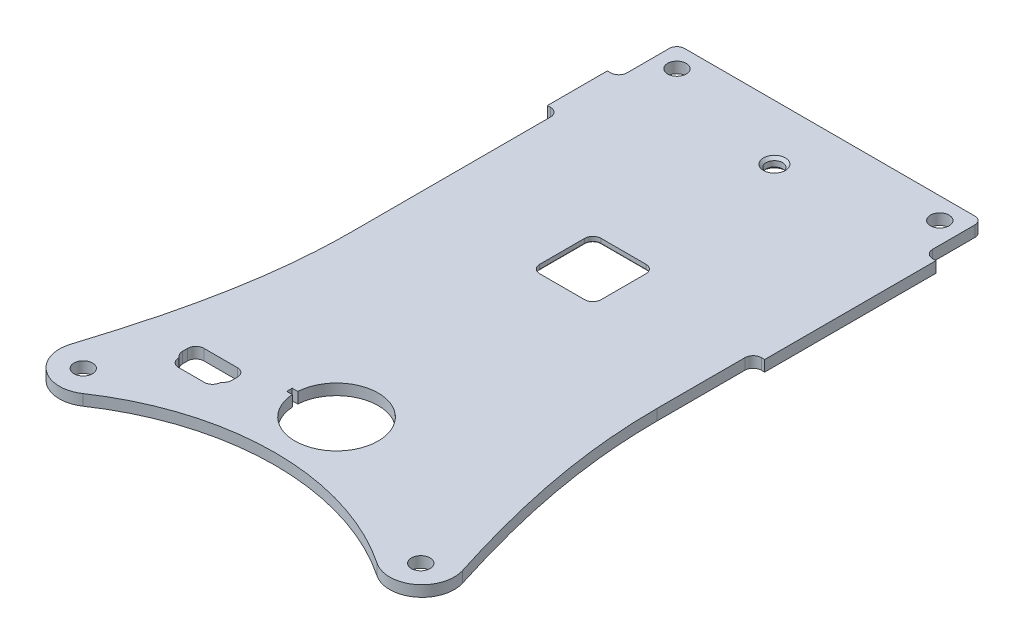
from build123d import *

# Parameters (mm, degrees)
VERT_ROD_W_VTULKA_1_START = 28
VERT_ROD_W_VTULKA_1_DEPTH = 2
CUT_EXTRUDE_1_DEPTH       = 2
HOLE_WIZARD_M32_D         = 3.4
HOLE_WIZARD_M32_DEPTH     = 2
HOLE_WIZARD_M32_TIP       = 1.021463052
HOLE_WIZARD_M33_D         = 3.4
HOLE_WIZARD_M33_DEPTH     = 2
HOLE_WIZARD_M33_TIP       = 1.021463052
HOLE_WIZARD_M34_D         = 3.4
HOLE_WIZARD_M34_DEPTH     = 2
HOLE_WIZARD_M34_TIP       = 1.021463052
HOLE_WIZARD_M35_D         = 3.4
HOLE_WIZARD_M35_DEPTH     = 2
HOLE_WIZARD_M35_TIP       = 1.021463052
HOLE_WIZARD_M36_D         = 3.4
HOLE_WIZARD_M36_DEPTH     = 2
HOLE_WIZARD_M36_TIP       = 1.021463052
HOLE_WIZARD_M37_D         = 3.4
HOLE_WIZARD_M37_DEPTH     = 2
HOLE_WIZARD_M37_TIP       = 1.021463052
HOLE_WIZARD_M38_D         = 3.4
HOLE_WIZARD_M38_DEPTH     = 2
HOLE_WIZARD_M38_TIP       = 1.021463052
HOLE_WIZARD_M39_D         = 3.4
HOLE_WIZARD_M39_DEPTH     = 2
HOLE_WIZARD_M39_TIP       = 1.021463052
HOLE_WIZARD_M310_D        = 3.4
HOLE_WIZARD_M310_DEPTH    = 2
HOLE_WIZARD_M310_TIP      = 1.021463052
HOLE_WIZARD_M311_D        = 3.4
HOLE_WIZARD_M311_DEPTH    = 2
HOLE_WIZARD_M311_TIP      = 1.021463052
SKETCH_25_W               = 2.1
SKETCH_25_H               = 31.28
EXTRUDE_1_DEPTH           = 2
HOLE_WIZARD_M312_D        = 3.4
HOLE_WIZARD_M312_DEPTH    = 2
HOLE_WIZARD_M312_TIP      = 1.021463052
HOLE_WIZARD_M313_D        = 3.4
HOLE_WIZARD_M313_DEPTH    = 2
HOLE_WIZARD_M313_TIP      = 1.021463052
HOLE_WIZARD_M314_D        = 3.4
HOLE_WIZARD_M314_DEPTH    = 2
HOLE_WIZARD_M314_TIP      = 1.021463052
HOLE_WIZARD_M315_D        = 3.4
HOLE_WIZARD_M315_DEPTH    = 2
HOLE_WIZARD_M315_TIP      = 1.021463052
HOLE_WIZARD_M316_D        = 3.4
HOLE_WIZARD_M316_DEPTH    = 2
HOLE_WIZARD_M316_TIP      = 1.021463052
HOLE_WIZARD_M317_D        = 3.4
HOLE_WIZARD_M317_DEPTH    = 2
HOLE_WIZARD_M317_TIP      = 1.021463052
HOLE_WIZARD_M318_D        = 3.4
HOLE_WIZARD_M318_DEPTH    = 2
HOLE_WIZARD_M318_TIP      = 1.021463052
HOLE_WIZARD_M319_D        = 3.4
HOLE_WIZARD_M319_DEPTH    = 2
HOLE_WIZARD_M319_TIP      = 1.021463052
HOLE_WIZARD_M320_D        = 3.4
HOLE_WIZARD_M320_DEPTH    = 2
HOLE_WIZARD_M320_TIP      = 1.021463052
HOLE_WIZARD_M321_D        = 3.4
HOLE_WIZARD_M321_DEPTH    = 2
HOLE_WIZARD_M321_TIP      = 1.021463052
HOLE_WIZARD_M322_D        = 3.4
HOLE_WIZARD_M322_DEPTH    = 2
HOLE_WIZARD_M322_TIP      = 1.021463052
HOLE_WIZARD_M323_D        = 3.4
HOLE_WIZARD_M323_DEPTH    = 2
HOLE_WIZARD_M323_TIP      = 1.021463052
HOLE_WIZARD_M324_D        = 3.4
HOLE_WIZARD_M324_DEPTH    = 2
HOLE_WIZARD_M324_TIP      = 1.021463052
HOLE_WIZARD_M325_D        = 3.4
HOLE_WIZARD_M325_DEPTH    = 2
HOLE_WIZARD_M325_TIP      = 1.021463052
HOLE_WIZARD_M326_D        = 3.4
HOLE_WIZARD_M326_DEPTH    = 2
HOLE_WIZARD_M326_TIP      = 1.021463052
HOLE_WIZARD_M327_D        = 3.4
HOLE_WIZARD_M327_DEPTH    = 2
HOLE_WIZARD_M327_TIP      = 1.021463052
HOLE_WIZARD_M328_D        = 3.4
HOLE_WIZARD_M328_DEPTH    = 2
HOLE_WIZARD_M328_TIP      = 1.021463052
HOLE_WIZARD_M329_D        = 3.4
HOLE_WIZARD_M329_DEPTH    = 2
HOLE_WIZARD_M329_TIP      = 1.021463052
FILLET_1_R                = 1.5
HOLE_WIZARD_M330_D        = 3.4
HOLE_WIZARD_M330_DEPTH    = 2
HOLE_WIZARD_M330_TIP      = 1.021463052
HOLE_WIZARD_M331_D        = 3.4
HOLE_WIZARD_M331_DEPTH    = 2
HOLE_WIZARD_M331_TIP      = 1.021463052
HOLE_WIZARD_M332_D        = 3.4
HOLE_WIZARD_M332_DEPTH    = 2
HOLE_WIZARD_M332_TIP      = 1.021463052
HOLE_WIZARD_M333_D        = 3.4
HOLE_WIZARD_M333_DEPTH    = 2
HOLE_WIZARD_M333_TIP      = 1.021463052
HOLE_WIZARD_M334_D        = 3.4
HOLE_WIZARD_M334_DEPTH    = 2
HOLE_WIZARD_M334_TIP      = 1.021463052
CUT_EXTRUDE_2_DEPTH       = 2
HOLE_WIZARD_M335_D        = 3.4
HOLE_WIZARD_M335_DEPTH    = 2
HOLE_WIZARD_M335_TIP      = 1.021463052
SKETCH_76_W               = 2.1
SKETCH_76_H               = 10.96
EXTRUDE_2_DEPTH           = 2
FILLET_2_R                = 1.5
HOLE_WIZARD_M336_D        = 3.4
HOLE_WIZARD_M336_DEPTH    = 2
HOLE_WIZARD_M336_TIP      = 1.021463052
HOLE_WIZARD_M337_D        = 3.4
HOLE_WIZARD_M337_DEPTH    = 2
HOLE_WIZARD_M337_TIP      = 1.021463052
HOLE_WIZARD_M338_D        = 3.4
HOLE_WIZARD_M338_DEPTH    = 2
HOLE_WIZARD_M338_TIP      = 1.021463052
HOLE_WIZARD_M339_D        = 3.4
HOLE_WIZARD_M339_DEPTH    = 2
HOLE_WIZARD_M339_TIP      = 1.021463052
HOLE_WIZARD_M340_D        = 3.4
HOLE_WIZARD_M340_DEPTH    = 2
HOLE_WIZARD_M340_TIP      = 1.021463052
HOLE_WIZARD_M341_D        = 3.4
HOLE_WIZARD_M341_DEPTH    = 2
HOLE_WIZARD_M341_TIP      = 1.021463052
HOLE_WIZARD_M342_D        = 3.4
HOLE_WIZARD_M342_DEPTH    = 2
HOLE_WIZARD_M342_TIP      = 1.021463052
HOLE_WIZARD_M343_D        = 3.4
HOLE_WIZARD_M343_DEPTH    = 2
HOLE_WIZARD_M343_TIP      = 1.021463052
HOLE_WIZARD_M344_D        = 3.4
HOLE_WIZARD_M344_DEPTH    = 2
HOLE_WIZARD_M344_TIP      = 1.021463052
HOLE_WIZARD_M345_D        = 3.4
HOLE_WIZARD_M345_DEPTH    = 2
HOLE_WIZARD_M345_TIP      = 1.021463052
HOLE_WIZARD_M346_D        = 3.4
HOLE_WIZARD_M346_DEPTH    = 2
HOLE_WIZARD_M346_TIP      = 1.021463052
HOLE_WIZARD_M347_D        = 3.4
HOLE_WIZARD_M347_DEPTH    = 2
HOLE_WIZARD_M347_TIP      = 1.021463052
HOLE_WIZARD_M348_D        = 3.4
HOLE_WIZARD_M348_DEPTH    = 2
HOLE_WIZARD_M348_TIP      = 1.021463052
HOLE_WIZARD_M349_D        = 3.4
HOLE_WIZARD_M349_DEPTH    = 2
HOLE_WIZARD_M349_TIP      = 1.021463052
HOLE_WIZARD_M350_D        = 3.4
HOLE_WIZARD_M350_DEPTH    = 2
HOLE_WIZARD_M350_TIP      = 1.021463052
HOLE_WIZARD_M351_D        = 3.4
HOLE_WIZARD_M351_DEPTH    = 2
HOLE_WIZARD_M351_TIP      = 1.021463052
HOLE_WIZARD_M352_D        = 3.4
HOLE_WIZARD_M352_DEPTH    = 2
HOLE_WIZARD_M352_TIP      = 1.021463052
HOLE_WIZARD_M353_D        = 3.4
HOLE_WIZARD_M353_DEPTH    = 2
HOLE_WIZARD_M353_TIP      = 1.021463052
HOLE_WIZARD_M354_D        = 3.4
HOLE_WIZARD_M354_DEPTH    = 2
HOLE_WIZARD_M354_TIP      = 1.021463052
HOLE_WIZARD_M355_D        = 3.4
HOLE_WIZARD_M355_DEPTH    = 2
HOLE_WIZARD_M355_TIP      = 1.021463052
HOLE_WIZARD_M356_D        = 3.4
HOLE_WIZARD_M356_DEPTH    = 2
HOLE_WIZARD_M356_TIP      = 1.021463052
HOLE_WIZARD_M357_D        = 3.4
HOLE_WIZARD_M357_DEPTH    = 2
HOLE_WIZARD_M357_TIP      = 1.021463052
HOLE_WIZARD_M358_D        = 3.4
HOLE_WIZARD_M358_DEPTH    = 2
HOLE_WIZARD_M358_TIP      = 1.021463052
SKETCH_123_R              = 7.6
CUT_EXTRUDE_3_DEPTH       = 121.787440724
SKETCH_124_W              = 2
SKETCH_124_H              = 1
CUT_EXTRUDE_4_DEPTH       = 121.787440724
CUT_EXTRUDE_5_DEPTH       = 121.787440724
HOLE_WIZARD_M359_D        = 3.4
HOLE_WIZARD_M359_DEPTH    = 2
HOLE_WIZARD_M359_TIP      = 1.021463052
FILLET_3_R                = 1.5
SKETCH_131_W              = 13.5
SKETCH_131_H              = 13.5
CUT_EXTRUDE_6_DEPTH       = 1.2
FILLET_4_R                = 1.5
SKETCH_132_R              = 1.5
CUT_EXTRUDE_7_DEPTH       = 121.787440724
CHAMFER_1_SIZE            = 0.5
HOLE_WIZARD_M360_D        = 3.4
HOLE_WIZARD_M360_DEPTH    = 2
HOLE_WIZARD_M360_TIP      = 1.021463052


# Read off the part's stored shape, not the designer's step: Припуск-Vert_rod_w_vtulka-1
with BuildPart() as part:
    # Припуск-Vert_rod_w_vtulka-1 outline → Припуск-Vert_rod_w_vtulka-1 (new body)
    with BuildSketch(Plane(origin=(0, 0, 0), x_dir=(1, 0, 0), z_dir=(0, 1, 0)).offset(VERT_ROD_W_VTULKA_1_START)):
        with BuildLine():
            Line((57.9, -50), (57.9, 9.4))
            Line((57.9, 9.4), (2.1, 9.4))
            Line((2.1, 9.4), (2.1, -50))
            add(Edge.make_bspline(
                [(2.1, -50), (2.099999708, -53.702093756), (1.892934302, -57.393018514), (1.115992256, -64.755298157), (0.549431015, -68.409554715), (-1.580606832, -79.306490561), (-3.568754299, -86.422318434), (-5.796769802, -93.474666863)],
                knots=[0, 0, 0, 0, 0.25, 0.25, 0.5, 0.5, 1, 1, 1, 1], degree=3))
            ThreePointArc((-5.796769802, -93.474666863), (-3.669922454, -99.944406822), (3.13868063, -100.099128581))
            ThreePointArc((3.13868063, -100.099128581), (30.000000814, -91.89999981), (56.86132072, -100.09912949))
            ThreePointArc((56.86132072, -100.09912949), (63.66953295, -99.944697708), (65.797056658, -93.475598404))
            add(Edge.make_bspline(
                [(65.797056658, -93.475598404), (64.681861992, -89.945689128), (63.625509471, -86.39851392), (61.715383372, -79.244721015), (60.863770171, -75.643731412), (59.444825005, -68.375684643), (58.880489881, -64.726556831), (58.107463811, -57.392195393), (57.9, -53.70670524), (57.9, -50)],
                knots=[0, 0, 0, 0, 0.25, 0.25, 0.5, 0.5, 0.75, 0.75, 1, 1, 1, 1], degree=3))
        make_face()
    extrude(amount=VERT_ROD_W_VTULKA_1_DEPTH)

    # Эскиз1 → Вырез-Вытянуть1 (cut)
    with BuildSketch(Plane(origin=(0, 30, 0), x_dir=(1, 0, 0), z_dir=(0, 1, 0))):
        with BuildLine():
            Line((10.05, -87.25), (10.06, -87.25))
            Line((10.06, -87.25), (12.450000002, -87.25))
            ThreePointArc((12.450000002, -87.25), (13.510660172, -86.810660172), (13.95, -85.750000002))
            Line((13.95, -85.750000002), (13.95, -85.747056275))
            Line((13.95, -85.747056275), (14.210660172, -85.486396103))
            ThreePointArc((14.210660172, -85.486396103), (14.535819299, -84.99976108), (14.65, -84.425735932))
            Line((14.65, -84.425735932), (14.65, -83.399999998))
            ThreePointArc((14.65, -83.399999998), (14.210660172, -82.339339828), (13.150000002, -81.9))
            Line((13.150000002, -81.9), (7.049999998, -81.9))
            ThreePointArc((7.049999998, -81.9), (5.989339828, -82.339339828), (5.550000001, -83.399999998))
            Line((5.550000001, -83.399999998), (5.550000002, -84.334015506))
            ThreePointArc((5.550000002, -84.334015506), (5.664180703, -84.908040653), (5.989339828, -85.394675676))
            Line((5.989339828, -85.394675676), (6.25, -85.655335849))
            Line((6.25, -85.655335849), (6.25, -85.750000002))
            ThreePointArc((6.25, -85.750000002), (6.689339828, -86.810660172), (7.749999998, -87.25))
            Line((7.749999998, -87.25), (10.05, -87.25))
        make_face()
    extrude(amount=-CUT_EXTRUDE_1_DEPTH, mode=Mode.SUBTRACT)

    # Отверстие с зазором M32
    with Locations(Plane(origin=(-23.477702409, 30, -0.712313714), x_dir=(1, 0, 0), z_dir=(0, 1, 0))):
        with Locations((29.477702409, 4.787686286), (77.477702409, 4.787686286), (84.288969806, -96.800804138), (22.666435012, -96.800804138)):
            Hole(HOLE_WIZARD_M32_D / 2, depth=HOLE_WIZARD_M32_DEPTH)
            with Locations((0, 0, -(HOLE_WIZARD_M32_DEPTH + HOLE_WIZARD_M32_TIP / 2))):  # 118° drill point
                Cone(0, HOLE_WIZARD_M32_D / 2, HOLE_WIZARD_M32_TIP, mode=Mode.SUBTRACT)

    # Отверстие с зазором M33
    with Locations(Plane(origin=(-23.477702409, 30, -0.712313714), x_dir=(1, 0, 0), z_dir=(0, 1, 0))):
        with Locations((29.477702409, 4.787686286), (77.477702409, 4.787686286), (84.288969806, -96.800804138), (22.666435012, -96.800804138)):
            Hole(HOLE_WIZARD_M33_D / 2, depth=HOLE_WIZARD_M33_DEPTH)
            with Locations((0, 0, -(HOLE_WIZARD_M33_DEPTH + HOLE_WIZARD_M33_TIP / 2))):  # 118° drill point
                Cone(0, HOLE_WIZARD_M33_D / 2, HOLE_WIZARD_M33_TIP, mode=Mode.SUBTRACT)

    # Отверстие с зазором M34
    with Locations(Plane(origin=(-23.477702409, 30, -0.712313714), x_dir=(1, 0, 0), z_dir=(0, 1, 0))):
        with Locations((29.477702409, 4.787686286), (77.477702409, 4.787686286), (84.288969806, -96.800804138), (22.666435012, -96.800804138)):
            Hole(HOLE_WIZARD_M34_D / 2, depth=HOLE_WIZARD_M34_DEPTH)
            with Locations((0, 0, -(HOLE_WIZARD_M34_DEPTH + HOLE_WIZARD_M34_TIP / 2))):  # 118° drill point
                Cone(0, HOLE_WIZARD_M34_D / 2, HOLE_WIZARD_M34_TIP, mode=Mode.SUBTRACT)

    # Отверстие с зазором M35
    with Locations(Plane(origin=(-23.477702409, 30, -0.712313714), x_dir=(1, 0, 0), z_dir=(0, 1, 0))):
        with Locations((29.477702409, 4.787686286), (77.477702409, 4.787686286), (84.288969806, -96.800804138), (22.666435012, -96.800804138)):
            Hole(HOLE_WIZARD_M35_D / 2, depth=HOLE_WIZARD_M35_DEPTH)
            with Locations((0, 0, -(HOLE_WIZARD_M35_DEPTH + HOLE_WIZARD_M35_TIP / 2))):  # 118° drill point
                Cone(0, HOLE_WIZARD_M35_D / 2, HOLE_WIZARD_M35_TIP, mode=Mode.SUBTRACT)

    # Отверстие с зазором M36
    with Locations(Plane(origin=(-23.477702409, 30, -0.712313714), x_dir=(1, 0, 0), z_dir=(0, 1, 0))):
        with Locations((29.477702409, 4.787686286), (77.477702409, 4.787686286), (84.288969806, -96.800804138), (22.666435012, -96.800804138)):
            Hole(HOLE_WIZARD_M36_D / 2, depth=HOLE_WIZARD_M36_DEPTH)
            with Locations((0, 0, -(HOLE_WIZARD_M36_DEPTH + HOLE_WIZARD_M36_TIP / 2))):  # 118° drill point
                Cone(0, HOLE_WIZARD_M36_D / 2, HOLE_WIZARD_M36_TIP, mode=Mode.SUBTRACT)

    # Отверстие с зазором M37
    with Locations(Plane(origin=(-23.477702409, 30, -0.712313714), x_dir=(1, 0, 0), z_dir=(0, 1, 0))):
        with Locations((29.477702409, 4.787686286), (77.477702409, 4.787686286), (84.288969806, -96.800804138), (22.666435012, -96.800804138)):
            Hole(HOLE_WIZARD_M37_D / 2, depth=HOLE_WIZARD_M37_DEPTH)
            with Locations((0, 0, -(HOLE_WIZARD_M37_DEPTH + HOLE_WIZARD_M37_TIP / 2))):  # 118° drill point
                Cone(0, HOLE_WIZARD_M37_D / 2, HOLE_WIZARD_M37_TIP, mode=Mode.SUBTRACT)

    # Отверстие с зазором M38
    with Locations(Plane(origin=(-23.477702409, 30, -0.712313714), x_dir=(1, 0, 0), z_dir=(0, 1, 0))):
        with Locations((29.477702409, 4.787686286), (77.477702409, 4.787686286), (84.288969806, -96.800804138), (22.666435012, -96.800804138)):
            Hole(HOLE_WIZARD_M38_D / 2, depth=HOLE_WIZARD_M38_DEPTH)
            with Locations((0, 0, -(HOLE_WIZARD_M38_DEPTH + HOLE_WIZARD_M38_TIP / 2))):  # 118° drill point
                Cone(0, HOLE_WIZARD_M38_D / 2, HOLE_WIZARD_M38_TIP, mode=Mode.SUBTRACT)

    # Отверстие с зазором M39
    with Locations(Plane(origin=(-23.477702409, 30, -0.712313714), x_dir=(1, 0, 0), z_dir=(0, 1, 0))):
        with Locations((29.477702409, 4.787686286), (77.477702409, 4.787686286), (84.288969806, -96.800804138), (22.666435012, -96.800804138)):
            Hole(HOLE_WIZARD_M39_D / 2, depth=HOLE_WIZARD_M39_DEPTH)
            with Locations((0, 0, -(HOLE_WIZARD_M39_DEPTH + HOLE_WIZARD_M39_TIP / 2))):  # 118° drill point
                Cone(0, HOLE_WIZARD_M39_D / 2, HOLE_WIZARD_M39_TIP, mode=Mode.SUBTRACT)

    # Отверстие с зазором M310
    with Locations(Plane(origin=(-23.477702409, 30, -0.712313714), x_dir=(1, 0, 0), z_dir=(0, 1, 0))):
        with Locations((29.477702409, 4.787686286), (77.477702409, 4.787686286), (84.288969806, -96.800804138), (22.666435012, -96.800804138)):
            Hole(HOLE_WIZARD_M310_D / 2, depth=HOLE_WIZARD_M310_DEPTH)
            with Locations((0, 0, -(HOLE_WIZARD_M310_DEPTH + HOLE_WIZARD_M310_TIP / 2))):  # 118° drill point
                Cone(0, HOLE_WIZARD_M310_D / 2, HOLE_WIZARD_M310_TIP, mode=Mode.SUBTRACT)

    # Отверстие с зазором M311
    with Locations(Plane(origin=(-23.477702409, 30, -0.712313714), x_dir=(1, 0, 0), z_dir=(0, 1, 0))):
        with Locations((29.477702409, 4.787686286), (77.477702409, 4.787686286), (84.288969806, -96.800804138), (22.666435012, -96.800804138)):
            Hole(HOLE_WIZARD_M311_D / 2, depth=HOLE_WIZARD_M311_DEPTH)
            with Locations((0, 0, -(HOLE_WIZARD_M311_DEPTH + HOLE_WIZARD_M311_TIP / 2))):  # 118° drill point
                Cone(0, HOLE_WIZARD_M311_D / 2, HOLE_WIZARD_M311_TIP, mode=Mode.SUBTRACT)

    # Эскиз25 → Бобышка-Вытянуть1 (add)
    with BuildSketch(Plane(origin=(0, 30, 0), x_dir=(1, 0, 0), z_dir=(0, 1, 0))):
        with Locations((58.95, -16.84)):
            Rectangle(SKETCH_25_W, SKETCH_25_H)
    extrude(amount=-EXTRUDE_1_DEPTH)

    # Отверстие с зазором M312
    with Locations(Plane(origin=(-23.477702409, 30, -0.712313714), x_dir=(1, 0, 0), z_dir=(0, 1, 0))):
        with Locations((29.477702409, 4.787686286), (77.477702409, 4.787686286), (84.288969806, -96.800804138), (22.666435012, -96.800804138)):
            Hole(HOLE_WIZARD_M312_D / 2, depth=HOLE_WIZARD_M312_DEPTH)
            with Locations((0, 0, -(HOLE_WIZARD_M312_DEPTH + HOLE_WIZARD_M312_TIP / 2))):  # 118° drill point
                Cone(0, HOLE_WIZARD_M312_D / 2, HOLE_WIZARD_M312_TIP, mode=Mode.SUBTRACT)

    # Отверстие с зазором M313
    with Locations(Plane(origin=(-23.477702409, 30, -0.712313714), x_dir=(1, 0, 0), z_dir=(0, 1, 0))):
        with Locations((29.477702409, 4.787686286), (77.477702409, 4.787686286), (84.288969806, -96.800804138), (22.666435012, -96.800804138)):
            Hole(HOLE_WIZARD_M313_D / 2, depth=HOLE_WIZARD_M313_DEPTH)
            with Locations((0, 0, -(HOLE_WIZARD_M313_DEPTH + HOLE_WIZARD_M313_TIP / 2))):  # 118° drill point
                Cone(0, HOLE_WIZARD_M313_D / 2, HOLE_WIZARD_M313_TIP, mode=Mode.SUBTRACT)

    # Отверстие с зазором M314
    with Locations(Plane(origin=(-23.477702409, 30, -0.712313714), x_dir=(1, 0, 0), z_dir=(0, 1, 0))):
        with Locations((29.477702409, 4.787686286), (77.477702409, 4.787686286), (84.288969806, -96.800804138), (22.666435012, -96.800804138)):
            Hole(HOLE_WIZARD_M314_D / 2, depth=HOLE_WIZARD_M314_DEPTH)
            with Locations((0, 0, -(HOLE_WIZARD_M314_DEPTH + HOLE_WIZARD_M314_TIP / 2))):  # 118° drill point
                Cone(0, HOLE_WIZARD_M314_D / 2, HOLE_WIZARD_M314_TIP, mode=Mode.SUBTRACT)

    # Отверстие с зазором M315
    with Locations(Plane(origin=(-23.477702409, 30, -0.712313714), x_dir=(1, 0, 0), z_dir=(0, 1, 0))):
        with Locations((29.477702409, 4.787686286), (77.477702409, 4.787686286), (84.288969806, -96.800804138), (22.666435012, -96.800804138)):
            Hole(HOLE_WIZARD_M315_D / 2, depth=HOLE_WIZARD_M315_DEPTH)
            with Locations((0, 0, -(HOLE_WIZARD_M315_DEPTH + HOLE_WIZARD_M315_TIP / 2))):  # 118° drill point
                Cone(0, HOLE_WIZARD_M315_D / 2, HOLE_WIZARD_M315_TIP, mode=Mode.SUBTRACT)

    # Отверстие с зазором M316
    with Locations(Plane(origin=(-23.477702409, 30, -0.712313714), x_dir=(1, 0, 0), z_dir=(0, 1, 0))):
        with Locations((29.477702409, 4.787686286), (77.477702409, 4.787686286), (84.288969806, -96.800804138), (22.666435012, -96.800804138)):
            Hole(HOLE_WIZARD_M316_D / 2, depth=HOLE_WIZARD_M316_DEPTH)
            with Locations((0, 0, -(HOLE_WIZARD_M316_DEPTH + HOLE_WIZARD_M316_TIP / 2))):  # 118° drill point
                Cone(0, HOLE_WIZARD_M316_D / 2, HOLE_WIZARD_M316_TIP, mode=Mode.SUBTRACT)

    # Отверстие с зазором M317
    with Locations(Plane(origin=(-23.477702409, 30, -0.712313714), x_dir=(1, 0, 0), z_dir=(0, 1, 0))):
        with Locations((29.477702409, 4.787686286), (77.477702409, 4.787686286), (84.288969806, -96.800804138), (22.666435012, -96.800804138)):
            Hole(HOLE_WIZARD_M317_D / 2, depth=HOLE_WIZARD_M317_DEPTH)
            with Locations((0, 0, -(HOLE_WIZARD_M317_DEPTH + HOLE_WIZARD_M317_TIP / 2))):  # 118° drill point
                Cone(0, HOLE_WIZARD_M317_D / 2, HOLE_WIZARD_M317_TIP, mode=Mode.SUBTRACT)

    # Отверстие с зазором M318
    with Locations(Plane(origin=(-23.477702409, 30, -0.712313714), x_dir=(1, 0, 0), z_dir=(0, 1, 0))):
        with Locations((29.477702409, 4.787686286), (77.477702409, 4.787686286), (84.288969806, -96.800804138), (22.666435012, -96.800804138)):
            Hole(HOLE_WIZARD_M318_D / 2, depth=HOLE_WIZARD_M318_DEPTH)
            with Locations((0, 0, -(HOLE_WIZARD_M318_DEPTH + HOLE_WIZARD_M318_TIP / 2))):  # 118° drill point
                Cone(0, HOLE_WIZARD_M318_D / 2, HOLE_WIZARD_M318_TIP, mode=Mode.SUBTRACT)

    # Отверстие с зазором M319
    with Locations(Plane(origin=(-23.477702409, 30, -0.712313714), x_dir=(1, 0, 0), z_dir=(0, 1, 0))):
        with Locations((29.477702409, 4.787686286), (77.477702409, 4.787686286), (84.288969806, -96.800804138), (22.666435012, -96.800804138)):
            Hole(HOLE_WIZARD_M319_D / 2, depth=HOLE_WIZARD_M319_DEPTH)
            with Locations((0, 0, -(HOLE_WIZARD_M319_DEPTH + HOLE_WIZARD_M319_TIP / 2))):  # 118° drill point
                Cone(0, HOLE_WIZARD_M319_D / 2, HOLE_WIZARD_M319_TIP, mode=Mode.SUBTRACT)

    # Отверстие с зазором M320
    with Locations(Plane(origin=(-23.477702409, 30, -0.712313714), x_dir=(1, 0, 0), z_dir=(0, 1, 0))):
        with Locations((29.477702409, 4.787686286), (77.477702409, 4.787686286), (84.288969806, -96.800804138), (22.666435012, -96.800804138)):
            Hole(HOLE_WIZARD_M320_D / 2, depth=HOLE_WIZARD_M320_DEPTH)
            with Locations((0, 0, -(HOLE_WIZARD_M320_DEPTH + HOLE_WIZARD_M320_TIP / 2))):  # 118° drill point
                Cone(0, HOLE_WIZARD_M320_D / 2, HOLE_WIZARD_M320_TIP, mode=Mode.SUBTRACT)

    # Отверстие с зазором M321
    with Locations(Plane(origin=(-23.477702409, 30, -0.712313714), x_dir=(1, 0, 0), z_dir=(0, 1, 0))):
        with Locations((29.477702409, 4.787686286), (77.477702409, 4.787686286), (84.288969806, -96.800804138), (22.666435012, -96.800804138)):
            Hole(HOLE_WIZARD_M321_D / 2, depth=HOLE_WIZARD_M321_DEPTH)
            with Locations((0, 0, -(HOLE_WIZARD_M321_DEPTH + HOLE_WIZARD_M321_TIP / 2))):  # 118° drill point
                Cone(0, HOLE_WIZARD_M321_D / 2, HOLE_WIZARD_M321_TIP, mode=Mode.SUBTRACT)

    # Отверстие с зазором M322
    with Locations(Plane(origin=(-23.477702409, 30, -0.712313714), x_dir=(1, 0, 0), z_dir=(0, 1, 0))):
        with Locations((29.477702409, 4.787686286), (77.477702409, 4.787686286), (84.288969806, -96.800804138), (22.666435012, -96.800804138)):
            Hole(HOLE_WIZARD_M322_D / 2, depth=HOLE_WIZARD_M322_DEPTH)
            with Locations((0, 0, -(HOLE_WIZARD_M322_DEPTH + HOLE_WIZARD_M322_TIP / 2))):  # 118° drill point
                Cone(0, HOLE_WIZARD_M322_D / 2, HOLE_WIZARD_M322_TIP, mode=Mode.SUBTRACT)

    # Отверстие с зазором M323
    with Locations(Plane(origin=(-23.477702409, 30, -0.712313714), x_dir=(1, 0, 0), z_dir=(0, 1, 0))):
        with Locations((29.477702409, 4.787686286), (77.477702409, 4.787686286), (84.288969806, -96.800804138), (22.666435012, -96.800804138)):
            Hole(HOLE_WIZARD_M323_D / 2, depth=HOLE_WIZARD_M323_DEPTH)
            with Locations((0, 0, -(HOLE_WIZARD_M323_DEPTH + HOLE_WIZARD_M323_TIP / 2))):  # 118° drill point
                Cone(0, HOLE_WIZARD_M323_D / 2, HOLE_WIZARD_M323_TIP, mode=Mode.SUBTRACT)

    # Отверстие с зазором M324
    with Locations(Plane(origin=(-23.477702409, 30, -0.712313714), x_dir=(1, 0, 0), z_dir=(0, 1, 0))):
        with Locations((29.477702409, 4.787686286), (77.477702409, 4.787686286), (84.288969806, -96.800804138), (22.666435012, -96.800804138)):
            Hole(HOLE_WIZARD_M324_D / 2, depth=HOLE_WIZARD_M324_DEPTH)
            with Locations((0, 0, -(HOLE_WIZARD_M324_DEPTH + HOLE_WIZARD_M324_TIP / 2))):  # 118° drill point
                Cone(0, HOLE_WIZARD_M324_D / 2, HOLE_WIZARD_M324_TIP, mode=Mode.SUBTRACT)

    # Отверстие с зазором M325
    with Locations(Plane(origin=(-23.477702409, 30, -0.712313714), x_dir=(1, 0, 0), z_dir=(0, 1, 0))):
        with Locations((29.477702409, 4.787686286), (77.477702409, 4.787686286), (84.288969806, -96.800804138), (22.666435012, -96.800804138)):
            Hole(HOLE_WIZARD_M325_D / 2, depth=HOLE_WIZARD_M325_DEPTH)
            with Locations((0, 0, -(HOLE_WIZARD_M325_DEPTH + HOLE_WIZARD_M325_TIP / 2))):  # 118° drill point
                Cone(0, HOLE_WIZARD_M325_D / 2, HOLE_WIZARD_M325_TIP, mode=Mode.SUBTRACT)

    # Отверстие с зазором M326
    with Locations(Plane(origin=(-23.477702409, 30, -0.712313714), x_dir=(1, 0, 0), z_dir=(0, 1, 0))):
        with Locations((29.477702409, 4.787686286), (77.477702409, 4.787686286), (84.288969806, -96.800804138), (22.666435012, -96.800804138)):
            Hole(HOLE_WIZARD_M326_D / 2, depth=HOLE_WIZARD_M326_DEPTH)
            with Locations((0, 0, -(HOLE_WIZARD_M326_DEPTH + HOLE_WIZARD_M326_TIP / 2))):  # 118° drill point
                Cone(0, HOLE_WIZARD_M326_D / 2, HOLE_WIZARD_M326_TIP, mode=Mode.SUBTRACT)

    # Отверстие с зазором M327
    with Locations(Plane(origin=(-23.477702409, 30, -0.712313714), x_dir=(1, 0, 0), z_dir=(0, 1, 0))):
        with Locations((29.477702409, 4.787686286), (77.477702409, 4.787686286), (84.288969806, -96.800804138), (22.666435012, -96.800804138)):
            Hole(HOLE_WIZARD_M327_D / 2, depth=HOLE_WIZARD_M327_DEPTH)
            with Locations((0, 0, -(HOLE_WIZARD_M327_DEPTH + HOLE_WIZARD_M327_TIP / 2))):  # 118° drill point
                Cone(0, HOLE_WIZARD_M327_D / 2, HOLE_WIZARD_M327_TIP, mode=Mode.SUBTRACT)

    # Отверстие с зазором M328
    with Locations(Plane(origin=(-23.477702409, 30, -0.712313714), x_dir=(1, 0, 0), z_dir=(0, 1, 0))):
        with Locations((29.477702409, 4.787686286), (77.477702409, 4.787686286), (84.288969806, -96.800804138), (22.666435012, -96.800804138)):
            Hole(HOLE_WIZARD_M328_D / 2, depth=HOLE_WIZARD_M328_DEPTH)
            with Locations((0, 0, -(HOLE_WIZARD_M328_DEPTH + HOLE_WIZARD_M328_TIP / 2))):  # 118° drill point
                Cone(0, HOLE_WIZARD_M328_D / 2, HOLE_WIZARD_M328_TIP, mode=Mode.SUBTRACT)

    # Отверстие с зазором M329
    with Locations(Plane(origin=(-23.477702409, 30, -0.712313714), x_dir=(1, 0, 0), z_dir=(0, 1, 0))):
        with Locations((29.477702409, 4.787686286), (77.477702409, 4.787686286), (84.288969806, -96.800804138), (22.666435012, -96.800804138)):
            Hole(HOLE_WIZARD_M329_D / 2, depth=HOLE_WIZARD_M329_DEPTH)
            with Locations((0, 0, -(HOLE_WIZARD_M329_DEPTH + HOLE_WIZARD_M329_TIP / 2))):  # 118° drill point
                Cone(0, HOLE_WIZARD_M329_D / 2, HOLE_WIZARD_M329_TIP, mode=Mode.SUBTRACT)

    # Скругление1
    fillet_1_edges = [part.edges().sort_by_distance(p)[0] for p in [
        (57.9, 29, 32.48),
        (57.9, 29, 1.2),
    ]]
    fillet(fillet_1_edges, radius=FILLET_1_R)

    # Отверстие с зазором M330
    with Locations(Plane(origin=(-23.477702409, 30, -0.712313714), x_dir=(1, 0, 0), z_dir=(0, 1, 0))):
        with Locations((29.477702409, 4.787686286), (77.477702409, 4.787686286), (84.288969806, -96.800804138), (22.666435012, -96.800804138)):
            Hole(HOLE_WIZARD_M330_D / 2, depth=HOLE_WIZARD_M330_DEPTH)
            with Locations((0, 0, -(HOLE_WIZARD_M330_DEPTH + HOLE_WIZARD_M330_TIP / 2))):  # 118° drill point
                Cone(0, HOLE_WIZARD_M330_D / 2, HOLE_WIZARD_M330_TIP, mode=Mode.SUBTRACT)

    # Отверстие с зазором M331
    with Locations(Plane(origin=(-23.477702409, 30, -0.712313714), x_dir=(1, 0, 0), z_dir=(0, 1, 0))):
        with Locations((29.477702409, 4.787686286), (77.477702409, 4.787686286), (84.288969806, -96.800804138), (22.666435012, -96.800804138)):
            Hole(HOLE_WIZARD_M331_D / 2, depth=HOLE_WIZARD_M331_DEPTH)
            with Locations((0, 0, -(HOLE_WIZARD_M331_DEPTH + HOLE_WIZARD_M331_TIP / 2))):  # 118° drill point
                Cone(0, HOLE_WIZARD_M331_D / 2, HOLE_WIZARD_M331_TIP, mode=Mode.SUBTRACT)

    # Отверстие с зазором M332
    with Locations(Plane(origin=(-23.477702409, 30, -0.712313714), x_dir=(1, 0, 0), z_dir=(0, 1, 0))):
        with Locations((29.477702409, 4.787686286), (77.477702409, 4.787686286), (84.288969806, -96.800804138), (22.666435012, -96.800804138)):
            Hole(HOLE_WIZARD_M332_D / 2, depth=HOLE_WIZARD_M332_DEPTH)
            with Locations((0, 0, -(HOLE_WIZARD_M332_DEPTH + HOLE_WIZARD_M332_TIP / 2))):  # 118° drill point
                Cone(0, HOLE_WIZARD_M332_D / 2, HOLE_WIZARD_M332_TIP, mode=Mode.SUBTRACT)

    # Отверстие с зазором M333
    with Locations(Plane(origin=(-23.477702409, 30, -0.712313714), x_dir=(1, 0, 0), z_dir=(0, 1, 0))):
        with Locations((29.477702409, 4.787686286), (77.477702409, 4.787686286), (84.288969806, -96.800804138), (22.666435012, -96.800804138)):
            Hole(HOLE_WIZARD_M333_D / 2, depth=HOLE_WIZARD_M333_DEPTH)
            with Locations((0, 0, -(HOLE_WIZARD_M333_DEPTH + HOLE_WIZARD_M333_TIP / 2))):  # 118° drill point
                Cone(0, HOLE_WIZARD_M333_D / 2, HOLE_WIZARD_M333_TIP, mode=Mode.SUBTRACT)

    # Отверстие с зазором M334
    with Locations(Plane(origin=(-23.477702409, 30, -0.712313714), x_dir=(1, 0, 0), z_dir=(0, 1, 0))):
        with Locations((29.477702409, 4.787686286), (77.477702409, 4.787686286), (84.288969806, -96.800804138), (22.666435012, -96.800804138)):
            Hole(HOLE_WIZARD_M334_D / 2, depth=HOLE_WIZARD_M334_DEPTH)
            with Locations((0, 0, -(HOLE_WIZARD_M334_DEPTH + HOLE_WIZARD_M334_TIP / 2))):  # 118° drill point
                Cone(0, HOLE_WIZARD_M334_D / 2, HOLE_WIZARD_M334_TIP, mode=Mode.SUBTRACT)

    # Эскиз73 → Вырез-Вытянуть2 (cut)
    with BuildSketch(Plane(origin=(0, 30, 0), x_dir=(1, 0, 0), z_dir=(0, 1, 0))):
        with BuildLine():
            Line((57.9, 9.4), (56.5, 9.4))
            ThreePointArc((56.5, 9.4), (57.489949494, 8.989949494), (57.9, 8))
            Line((57.9, 8), (57.9, 9.4))
        make_face()
        with BuildLine():
            Line((2.1, 9.4), (2.1, 8))
            ThreePointArc((2.1, 8), (2.510050506, 8.989949494), (3.5, 9.4))
            Line((3.5, 9.4), (2.1, 9.4))
        make_face()
    extrude(amount=-CUT_EXTRUDE_2_DEPTH, mode=Mode.SUBTRACT)

    # Отверстие с зазором M335
    with Locations(Plane(origin=(-23.477702409, 30, -0.712313714), x_dir=(1, 0, 0), z_dir=(0, 1, 0))):
        with Locations((29.477702409, 4.787686286), (77.477702409, 4.787686286), (84.288969806, -96.800804138), (22.666435012, -96.800804138)):
            Hole(HOLE_WIZARD_M335_D / 2, depth=HOLE_WIZARD_M335_DEPTH)
            with Locations((0, 0, -(HOLE_WIZARD_M335_DEPTH + HOLE_WIZARD_M335_TIP / 2))):  # 118° drill point
                Cone(0, HOLE_WIZARD_M335_D / 2, HOLE_WIZARD_M335_TIP, mode=Mode.SUBTRACT)

    # Эскиз76 → Бобышка-Вытянуть2 (add)
    with BuildSketch(Plane(origin=(0, 30, 0), x_dir=(1, 0, 0), z_dir=(0, 1, 0))):
        with Locations((1.05, -6.68)):
            Rectangle(SKETCH_76_W, SKETCH_76_H)
    extrude(amount=-EXTRUDE_2_DEPTH)

    # Скругление2
    fillet_2_edges = [part.edges().sort_by_distance(p)[0] for p in [
        (2.1, 29, 12.16),
        (2.1, 29, 1.2),
    ]]
    fillet(fillet_2_edges, radius=FILLET_2_R)

    # Отверстие с зазором M336
    with Locations(Plane(origin=(-23.477702409, 30, -0.712313714), x_dir=(1, 0, 0), z_dir=(0, 1, 0))):
        with Locations((29.477702409, 4.787686286), (77.477702409, 4.787686286), (84.288969806, -96.800804138), (22.666435012, -96.800804138)):
            Hole(HOLE_WIZARD_M336_D / 2, depth=HOLE_WIZARD_M336_DEPTH)
            with Locations((0, 0, -(HOLE_WIZARD_M336_DEPTH + HOLE_WIZARD_M336_TIP / 2))):  # 118° drill point
                Cone(0, HOLE_WIZARD_M336_D / 2, HOLE_WIZARD_M336_TIP, mode=Mode.SUBTRACT)

    # Отверстие с зазором M337
    with Locations(Plane(origin=(-23.477702409, 30, -0.712313714), x_dir=(1, 0, 0), z_dir=(0, 1, 0))):
        with Locations((29.477702409, 4.787686286), (77.477702409, 4.787686286), (84.288969806, -96.800804138), (22.666435012, -96.800804138)):
            Hole(HOLE_WIZARD_M337_D / 2, depth=HOLE_WIZARD_M337_DEPTH)
            with Locations((0, 0, -(HOLE_WIZARD_M337_DEPTH + HOLE_WIZARD_M337_TIP / 2))):  # 118° drill point
                Cone(0, HOLE_WIZARD_M337_D / 2, HOLE_WIZARD_M337_TIP, mode=Mode.SUBTRACT)

    # Отверстие с зазором M338
    with Locations(Plane(origin=(-23.477702409, 30, -0.712313714), x_dir=(1, 0, 0), z_dir=(0, 1, 0))):
        with Locations((29.477702409, 4.787686286), (77.477702409, 4.787686286), (84.288969806, -96.800804138), (22.666435012, -96.800804138)):
            Hole(HOLE_WIZARD_M338_D / 2, depth=HOLE_WIZARD_M338_DEPTH)
            with Locations((0, 0, -(HOLE_WIZARD_M338_DEPTH + HOLE_WIZARD_M338_TIP / 2))):  # 118° drill point
                Cone(0, HOLE_WIZARD_M338_D / 2, HOLE_WIZARD_M338_TIP, mode=Mode.SUBTRACT)

    # Отверстие с зазором M339
    with Locations(Plane(origin=(-23.477702409, 30, -0.712313714), x_dir=(1, 0, 0), z_dir=(0, 1, 0))):
        with Locations((29.477702409, 4.787686286), (77.477702409, 4.787686286), (84.288969806, -96.800804138), (22.666435012, -96.800804138)):
            Hole(HOLE_WIZARD_M339_D / 2, depth=HOLE_WIZARD_M339_DEPTH)
            with Locations((0, 0, -(HOLE_WIZARD_M339_DEPTH + HOLE_WIZARD_M339_TIP / 2))):  # 118° drill point
                Cone(0, HOLE_WIZARD_M339_D / 2, HOLE_WIZARD_M339_TIP, mode=Mode.SUBTRACT)

    # Отверстие с зазором M340
    with Locations(Plane(origin=(-23.477702409, 30, -0.712313714), x_dir=(1, 0, 0), z_dir=(0, 1, 0))):
        with Locations((29.477702409, 4.787686286), (77.477702409, 4.787686286), (84.288969806, -96.800804138), (22.666435012, -96.800804138)):
            Hole(HOLE_WIZARD_M340_D / 2, depth=HOLE_WIZARD_M340_DEPTH)
            with Locations((0, 0, -(HOLE_WIZARD_M340_DEPTH + HOLE_WIZARD_M340_TIP / 2))):  # 118° drill point
                Cone(0, HOLE_WIZARD_M340_D / 2, HOLE_WIZARD_M340_TIP, mode=Mode.SUBTRACT)

    # Отверстие с зазором M341
    with Locations(Plane(origin=(-23.477702409, 30, -0.712313714), x_dir=(1, 0, 0), z_dir=(0, 1, 0))):
        with Locations((29.477702409, 4.787686286), (77.477702409, 4.787686286), (84.288969806, -96.800804138), (22.666435012, -96.800804138)):
            Hole(HOLE_WIZARD_M341_D / 2, depth=HOLE_WIZARD_M341_DEPTH)
            with Locations((0, 0, -(HOLE_WIZARD_M341_DEPTH + HOLE_WIZARD_M341_TIP / 2))):  # 118° drill point
                Cone(0, HOLE_WIZARD_M341_D / 2, HOLE_WIZARD_M341_TIP, mode=Mode.SUBTRACT)

    # Отверстие с зазором M342
    with Locations(Plane(origin=(-23.477702409, 30, -0.712313714), x_dir=(1, 0, 0), z_dir=(0, 1, 0))):
        with Locations((29.477702409, 4.787686286), (77.477702409, 4.787686286), (84.288969806, -96.800804138), (22.666435012, -96.800804138)):
            Hole(HOLE_WIZARD_M342_D / 2, depth=HOLE_WIZARD_M342_DEPTH)
            with Locations((0, 0, -(HOLE_WIZARD_M342_DEPTH + HOLE_WIZARD_M342_TIP / 2))):  # 118° drill point
                Cone(0, HOLE_WIZARD_M342_D / 2, HOLE_WIZARD_M342_TIP, mode=Mode.SUBTRACT)

    # Отверстие с зазором M343
    with Locations(Plane(origin=(-23.477702409, 30, -0.712313714), x_dir=(1, 0, 0), z_dir=(0, 1, 0))):
        with Locations((29.477702409, 4.787686286), (77.477702409, 4.787686286), (84.288969806, -96.800804138), (22.666435012, -96.800804138)):
            Hole(HOLE_WIZARD_M343_D / 2, depth=HOLE_WIZARD_M343_DEPTH)
            with Locations((0, 0, -(HOLE_WIZARD_M343_DEPTH + HOLE_WIZARD_M343_TIP / 2))):  # 118° drill point
                Cone(0, HOLE_WIZARD_M343_D / 2, HOLE_WIZARD_M343_TIP, mode=Mode.SUBTRACT)

    # Отверстие с зазором M344
    with Locations(Plane(origin=(-23.477702409, 30, -0.712313714), x_dir=(1, 0, 0), z_dir=(0, 1, 0))):
        with Locations((29.477702409, 4.787686286), (77.477702409, 4.787686286), (84.288969806, -96.800804138), (22.666435012, -96.800804138)):
            Hole(HOLE_WIZARD_M344_D / 2, depth=HOLE_WIZARD_M344_DEPTH)
            with Locations((0, 0, -(HOLE_WIZARD_M344_DEPTH + HOLE_WIZARD_M344_TIP / 2))):  # 118° drill point
                Cone(0, HOLE_WIZARD_M344_D / 2, HOLE_WIZARD_M344_TIP, mode=Mode.SUBTRACT)

    # Отверстие с зазором M345
    with Locations(Plane(origin=(-23.477702409, 30, -0.712313714), x_dir=(1, 0, 0), z_dir=(0, 1, 0))):
        with Locations((29.477702409, 4.787686286), (77.477702409, 4.787686286), (84.288969806, -96.800804138), (22.666435012, -96.800804138)):
            Hole(HOLE_WIZARD_M345_D / 2, depth=HOLE_WIZARD_M345_DEPTH)
            with Locations((0, 0, -(HOLE_WIZARD_M345_DEPTH + HOLE_WIZARD_M345_TIP / 2))):  # 118° drill point
                Cone(0, HOLE_WIZARD_M345_D / 2, HOLE_WIZARD_M345_TIP, mode=Mode.SUBTRACT)

    # Отверстие с зазором M346
    with Locations(Plane(origin=(-23.477702409, 30, -0.712313714), x_dir=(1, 0, 0), z_dir=(0, 1, 0))):
        with Locations((29.477702409, 4.787686286), (77.477702409, 4.787686286), (84.288969806, -96.800804138), (22.666435012, -96.800804138)):
            Hole(HOLE_WIZARD_M346_D / 2, depth=HOLE_WIZARD_M346_DEPTH)
            with Locations((0, 0, -(HOLE_WIZARD_M346_DEPTH + HOLE_WIZARD_M346_TIP / 2))):  # 118° drill point
                Cone(0, HOLE_WIZARD_M346_D / 2, HOLE_WIZARD_M346_TIP, mode=Mode.SUBTRACT)

    # Отверстие с зазором M347
    with Locations(Plane(origin=(-23.477702409, 30, -0.712313714), x_dir=(1, 0, 0), z_dir=(0, 1, 0))):
        with Locations((29.477702409, 4.787686286), (77.477702409, 4.787686286), (84.288969806, -96.800804138), (22.666435012, -96.800804138)):
            Hole(HOLE_WIZARD_M347_D / 2, depth=HOLE_WIZARD_M347_DEPTH)
            with Locations((0, 0, -(HOLE_WIZARD_M347_DEPTH + HOLE_WIZARD_M347_TIP / 2))):  # 118° drill point
                Cone(0, HOLE_WIZARD_M347_D / 2, HOLE_WIZARD_M347_TIP, mode=Mode.SUBTRACT)

    # Отверстие с зазором M348
    with Locations(Plane(origin=(-23.477702409, 30, -0.712313714), x_dir=(1, 0, 0), z_dir=(0, 1, 0))):
        with Locations((29.477702409, 4.787686286), (77.477702409, 4.787686286), (84.288969806, -96.800804138), (22.666435012, -96.800804138)):
            Hole(HOLE_WIZARD_M348_D / 2, depth=HOLE_WIZARD_M348_DEPTH)
            with Locations((0, 0, -(HOLE_WIZARD_M348_DEPTH + HOLE_WIZARD_M348_TIP / 2))):  # 118° drill point
                Cone(0, HOLE_WIZARD_M348_D / 2, HOLE_WIZARD_M348_TIP, mode=Mode.SUBTRACT)

    # Отверстие с зазором M349
    with Locations(Plane(origin=(-23.477702409, 30, -0.712313714), x_dir=(1, 0, 0), z_dir=(0, 1, 0))):
        with Locations((29.477702409, 4.787686286), (77.477702409, 4.787686286), (84.288969806, -96.800804138), (22.666435012, -96.800804138)):
            Hole(HOLE_WIZARD_M349_D / 2, depth=HOLE_WIZARD_M349_DEPTH)
            with Locations((0, 0, -(HOLE_WIZARD_M349_DEPTH + HOLE_WIZARD_M349_TIP / 2))):  # 118° drill point
                Cone(0, HOLE_WIZARD_M349_D / 2, HOLE_WIZARD_M349_TIP, mode=Mode.SUBTRACT)

    # Отверстие с зазором M350
    with Locations(Plane(origin=(-23.477702409, 30, -0.712313714), x_dir=(1, 0, 0), z_dir=(0, 1, 0))):
        with Locations((29.477702409, 4.787686286), (77.477702409, 4.787686286), (84.288969806, -96.800804138), (22.666435012, -96.800804138)):
            Hole(HOLE_WIZARD_M350_D / 2, depth=HOLE_WIZARD_M350_DEPTH)
            with Locations((0, 0, -(HOLE_WIZARD_M350_DEPTH + HOLE_WIZARD_M350_TIP / 2))):  # 118° drill point
                Cone(0, HOLE_WIZARD_M350_D / 2, HOLE_WIZARD_M350_TIP, mode=Mode.SUBTRACT)

    # Отверстие с зазором M351
    with Locations(Plane(origin=(-23.477702409, 30, -0.712313714), x_dir=(1, 0, 0), z_dir=(0, 1, 0))):
        with Locations((29.477702409, 4.787686286), (77.477702409, 4.787686286), (84.288969806, -96.800804138), (22.666435012, -96.800804138)):
            Hole(HOLE_WIZARD_M351_D / 2, depth=HOLE_WIZARD_M351_DEPTH)
            with Locations((0, 0, -(HOLE_WIZARD_M351_DEPTH + HOLE_WIZARD_M351_TIP / 2))):  # 118° drill point
                Cone(0, HOLE_WIZARD_M351_D / 2, HOLE_WIZARD_M351_TIP, mode=Mode.SUBTRACT)

    # Отверстие с зазором M352
    with Locations(Plane(origin=(-23.477702409, 30, -0.712313714), x_dir=(1, 0, 0), z_dir=(0, 1, 0))):
        with Locations((29.477702409, 4.787686286), (77.477702409, 4.787686286), (84.288969806, -96.800804138), (22.666435012, -96.800804138)):
            Hole(HOLE_WIZARD_M352_D / 2, depth=HOLE_WIZARD_M352_DEPTH)
            with Locations((0, 0, -(HOLE_WIZARD_M352_DEPTH + HOLE_WIZARD_M352_TIP / 2))):  # 118° drill point
                Cone(0, HOLE_WIZARD_M352_D / 2, HOLE_WIZARD_M352_TIP, mode=Mode.SUBTRACT)

    # Отверстие с зазором M353
    with Locations(Plane(origin=(-23.477702409, 30, -0.712313714), x_dir=(1, 0, 0), z_dir=(0, 1, 0))):
        with Locations((29.477702409, 4.787686286), (77.477702409, 4.787686286), (84.288969806, -96.800804138), (22.666435012, -96.800804138)):
            Hole(HOLE_WIZARD_M353_D / 2, depth=HOLE_WIZARD_M353_DEPTH)
            with Locations((0, 0, -(HOLE_WIZARD_M353_DEPTH + HOLE_WIZARD_M353_TIP / 2))):  # 118° drill point
                Cone(0, HOLE_WIZARD_M353_D / 2, HOLE_WIZARD_M353_TIP, mode=Mode.SUBTRACT)

    # Отверстие с зазором M354
    with Locations(Plane(origin=(-23.477702409, 30, -0.712313714), x_dir=(1, 0, 0), z_dir=(0, 1, 0))):
        with Locations((29.477702409, 4.787686286), (77.477702409, 4.787686286), (84.288969806, -96.800804138), (22.666435012, -96.800804138)):
            Hole(HOLE_WIZARD_M354_D / 2, depth=HOLE_WIZARD_M354_DEPTH)
            with Locations((0, 0, -(HOLE_WIZARD_M354_DEPTH + HOLE_WIZARD_M354_TIP / 2))):  # 118° drill point
                Cone(0, HOLE_WIZARD_M354_D / 2, HOLE_WIZARD_M354_TIP, mode=Mode.SUBTRACT)

    # Отверстие с зазором M355
    with Locations(Plane(origin=(-23.477702409, 30, -0.712313714), x_dir=(1, 0, 0), z_dir=(0, 1, 0))):
        with Locations((29.477702409, 4.787686286), (77.477702409, 4.787686286), (84.288969806, -96.800804138), (22.666435012, -96.800804138)):
            Hole(HOLE_WIZARD_M355_D / 2, depth=HOLE_WIZARD_M355_DEPTH)
            with Locations((0, 0, -(HOLE_WIZARD_M355_DEPTH + HOLE_WIZARD_M355_TIP / 2))):  # 118° drill point
                Cone(0, HOLE_WIZARD_M355_D / 2, HOLE_WIZARD_M355_TIP, mode=Mode.SUBTRACT)

    # Отверстие с зазором M356
    with Locations(Plane(origin=(-23.477702409, 30, -0.712313714), x_dir=(1, 0, 0), z_dir=(0, 1, 0))):
        with Locations((29.477702409, 4.787686286), (77.477702409, 4.787686286), (84.288969806, -96.800804138), (22.666435012, -96.800804138)):
            Hole(HOLE_WIZARD_M356_D / 2, depth=HOLE_WIZARD_M356_DEPTH)
            with Locations((0, 0, -(HOLE_WIZARD_M356_DEPTH + HOLE_WIZARD_M356_TIP / 2))):  # 118° drill point
                Cone(0, HOLE_WIZARD_M356_D / 2, HOLE_WIZARD_M356_TIP, mode=Mode.SUBTRACT)

    # Отверстие с зазором M357
    with Locations(Plane(origin=(-23.477702409, 30, -0.712313714), x_dir=(1, 0, 0), z_dir=(0, 1, 0))):
        with Locations((29.477702409, 4.787686286), (77.477702409, 4.787686286), (84.288969806, -96.800804138), (22.666435012, -96.800804138)):
            Hole(HOLE_WIZARD_M357_D / 2, depth=HOLE_WIZARD_M357_DEPTH)
            with Locations((0, 0, -(HOLE_WIZARD_M357_DEPTH + HOLE_WIZARD_M357_TIP / 2))):  # 118° drill point
                Cone(0, HOLE_WIZARD_M357_D / 2, HOLE_WIZARD_M357_TIP, mode=Mode.SUBTRACT)

    # Отверстие с зазором M358
    with Locations(Plane(origin=(-23.477702409, 30, -0.712313714), x_dir=(1, 0, 0), z_dir=(0, 1, 0))):
        with Locations((29.477702409, 4.787686286), (77.477702409, 4.787686286), (84.288969806, -96.800804138), (22.666435012, -96.800804138)):
            Hole(HOLE_WIZARD_M358_D / 2, depth=HOLE_WIZARD_M358_DEPTH)
            with Locations((0, 0, -(HOLE_WIZARD_M358_DEPTH + HOLE_WIZARD_M358_TIP / 2))):  # 118° drill point
                Cone(0, HOLE_WIZARD_M358_D / 2, HOLE_WIZARD_M358_TIP, mode=Mode.SUBTRACT)

    # Эскиз123 → Вырез-Вытянуть3 (cut, through all)
    with BuildSketch(Plane(origin=(0, 30, 0), x_dir=(1, 0, 0), z_dir=(0, 1, 0))):
        with Locations(Location((30, -80.64999981, 0), (0, 0, 180))):
            Circle(SKETCH_123_R)
    extrude(amount=-CUT_EXTRUDE_3_DEPTH, mode=Mode.SUBTRACT)

    # Эскиз124 → Вырез-Вытянуть4 (cut, through all)
    with BuildSketch(Plane(origin=(0, 30, 0), x_dir=(1, 0, 0), z_dir=(0, 1, 0))):
        with Locations((22.4, -80.64999981)):
            Rectangle(SKETCH_124_W, SKETCH_124_H)
    extrude(amount=-CUT_EXTRUDE_4_DEPTH, mode=Mode.SUBTRACT)

    # Эскиз126 → Вырез-Вытянуть5 (cut, through all)
    with BuildSketch(Plane(origin=(0, 30, 0), x_dir=(1, 0, 0), z_dir=(0, 1, 0))):
        Polygon((35, -39.45), (35.6, -39.45), (35.6, -28.25), (24.4, -28.25), (24.4, -39.45), (25, -39.45), align=None)
    extrude(amount=-CUT_EXTRUDE_5_DEPTH, mode=Mode.SUBTRACT)

    # Отверстие с зазором M359
    with Locations(Plane(origin=(-23.477702409, 30, -0.712313714), x_dir=(1, 0, 0), z_dir=(0, 1, 0))):
        with Locations((29.477702409, 4.787686286), (77.477702409, 4.787686286), (84.288969806, -96.800804138), (22.666435012, -96.800804138)):
            Hole(HOLE_WIZARD_M359_D / 2, depth=HOLE_WIZARD_M359_DEPTH)
            with Locations((0, 0, -(HOLE_WIZARD_M359_DEPTH + HOLE_WIZARD_M359_TIP / 2))):  # 118° drill point
                Cone(0, HOLE_WIZARD_M359_D / 2, HOLE_WIZARD_M359_TIP, mode=Mode.SUBTRACT)

    # Скругление3
    fillet_3_edges = [part.edges().sort_by_distance(p)[0] for p in [
        (24.4, 29, 39.45),
        (24.4, 29, 28.25),
        (35.6, 29, 28.25),
        (35.6, 29, 39.45),
    ]]
    fillet(fillet_3_edges, radius=FILLET_3_R)

    # Эскиз131 → Вырез-Вытянуть6 (cut)
    with BuildSketch(Plane.XZ.offset(-28)):
        with Locations((30, 33.85)):
            Rectangle(SKETCH_131_W, SKETCH_131_H)
    extrude(amount=-CUT_EXTRUDE_6_DEPTH, mode=Mode.SUBTRACT)

    # Скругление4
    fillet_4_edges = [part.edges().sort_by_distance(p)[0] for p in [
        (36.75, 28.6, 40.6),
        (36.75, 28.6, 27.1),
        (23.25, 28.6, 27.1),
        (23.25, 28.6, 40.6),
    ]]
    fillet(fillet_4_edges, radius=FILLET_4_R)

    # Эскиз132 → Вырез-Вытянуть7 (cut, through all)
    with BuildSketch(Plane(origin=(0, 30, 0), x_dir=(1, 0, 0), z_dir=(0, 1, 0))):
        with Locations(Location((30, -0.7, 0), (0, 0, 180))):
            Circle(SKETCH_132_R)
    extrude(amount=-CUT_EXTRUDE_7_DEPTH, mode=Mode.SUBTRACT)

    # Фаска1
    chamfer_1_edges = [part.edges().sort_by_distance(p)[0] for p in [
        (31.5, 28, 0.7),
        (31.5, 30, 0.7),
    ]]
    chamfer(chamfer_1_edges, length=CHAMFER_1_SIZE)

    # Отверстие с зазором M360
    with Locations(Plane(origin=(-23.477702409, 30, -0.712313714), x_dir=(1, 0, 0), z_dir=(0, 1, 0))):
        with Locations((29.477702409, 4.787686286), (77.477702409, 4.787686286), (84.288969806, -96.800804138), (22.666435012, -96.800804138)):
            Hole(HOLE_WIZARD_M360_D / 2, depth=HOLE_WIZARD_M360_DEPTH)
            with Locations((0, 0, -(HOLE_WIZARD_M360_DEPTH + HOLE_WIZARD_M360_TIP / 2))):  # 118° drill point
                Cone(0, HOLE_WIZARD_M360_D / 2, HOLE_WIZARD_M360_TIP, mode=Mode.SUBTRACT)


solid = part.part
